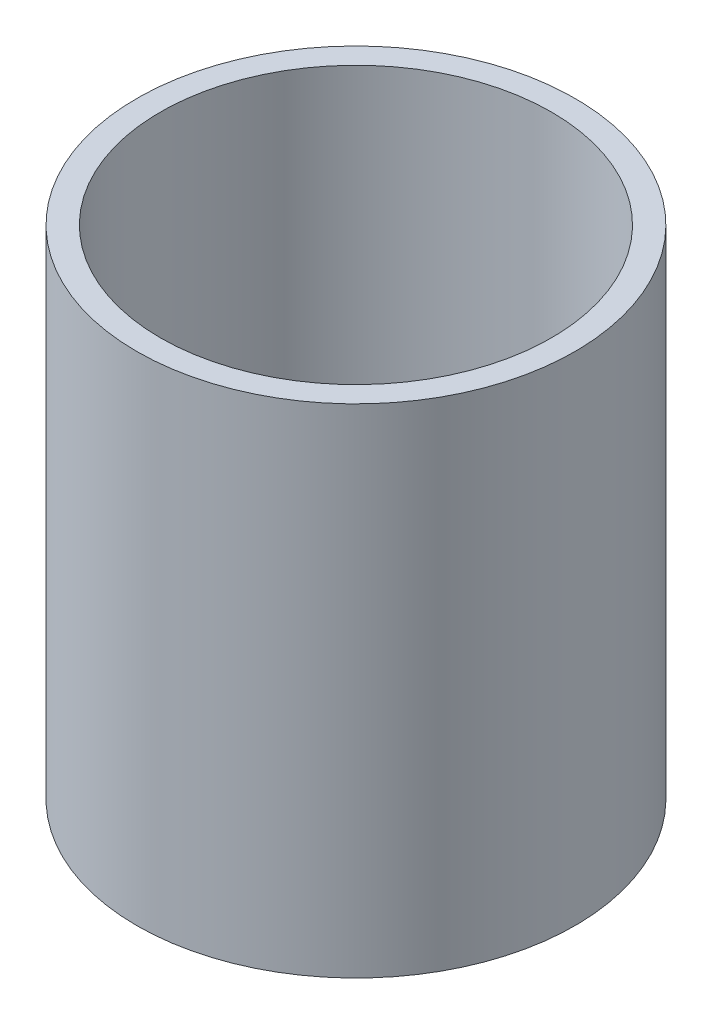
from build123d import *

# Parameters (mm, degrees)
SKETCH1_R           = 50
BOSS_EXTRUDE1_DEPTH = 113.442398239
SKETCH2_R           = 44.619312659
CUT_EXTRUDE1_DEPTH  = 134.675643699


with BuildPart() as part:
    # Sketch1 → Boss-Extrude1 (new body)
    with BuildSketch(Plane(origin=(0, 0, 0), x_dir=(1, 0, 0), z_dir=(0, 1, 0))):
        Circle(SKETCH1_R)
    extrude(amount=BOSS_EXTRUDE1_DEPTH)

    # Sketch2 → Cut-Extrude1 (cut, through all)
    with BuildSketch(Plane(origin=(0, 0, 0), x_dir=(1, 0, 0), z_dir=(0, 1, 0))):
        Circle(SKETCH2_R)
    extrude(amount=CUT_EXTRUDE1_DEPTH, mode=Mode.SUBTRACT)


solid = part.part
